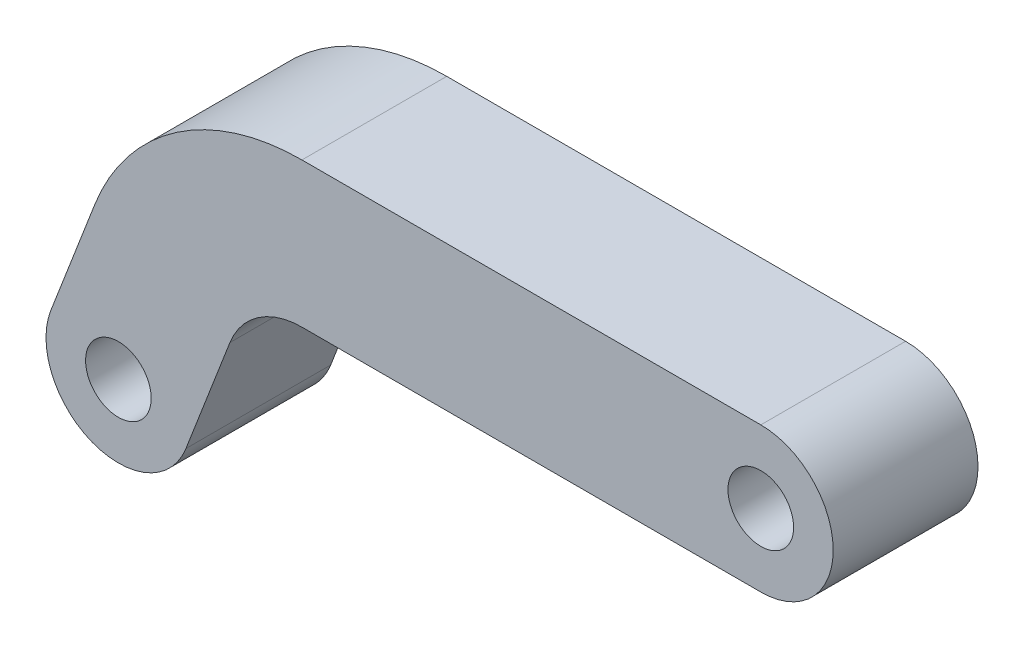
from build123d import *

# Parameters (mm, degrees)
SKETCH1_R           = 2.159
BOSS_EXTRUDE1_DEPTH = 4.7625


with BuildPart() as part:
    # Sketch1 → Boss-Extrude1 (new, symmetric)
    with BuildSketch(Plane.XY):
        with BuildLine():
            Line((42.26023994, 18.542), (12.074354268, 18.542))
            ThreePointArc((12.074354268, 18.542), (3.81625439, 15.983153386), (-1.548150054, 9.203251133))
            Line((-1.548150054, 9.203251133), (-4.442120975, 1.717255804))
            ThreePointArc((-4.442120975, 1.717255804), (-1.717255804, -4.442120975), (4.442120975, -1.717255804))
            Line((4.442120975, -1.717255804), (7.336091896, 5.768739524))
            ThreePointArc((7.336091896, 5.768739524), (9.201971702, 8.126966395), (12.074354268, 9.017))
            Line((12.074354268, 9.017), (42.26023994, 9.017))
            ThreePointArc((42.26023994, 9.017), (47.02273994, 13.7795), (42.26023994, 18.542))
        make_face()
        Circle(SKETCH1_R, mode=Mode.SUBTRACT)
        with Locations((42.26023994, 13.7795)):
            Circle(SKETCH1_R, mode=Mode.SUBTRACT)
    extrude(amount=BOSS_EXTRUDE1_DEPTH, both=True)


solid = part.part
